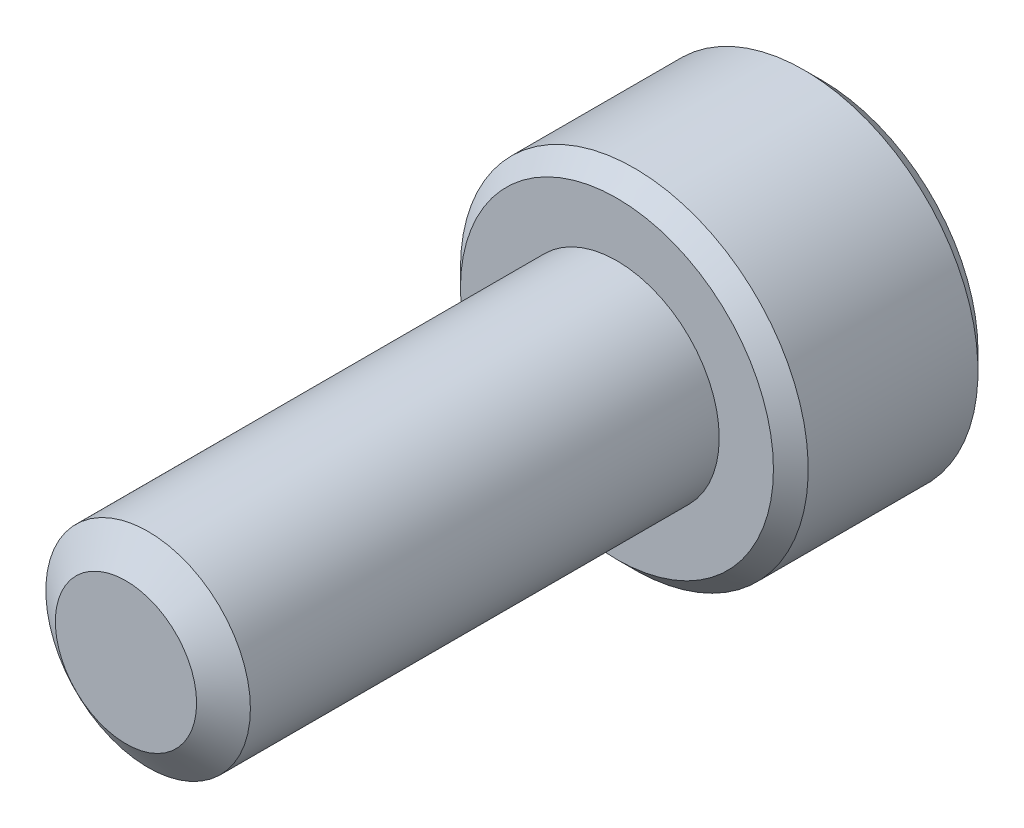
from build123d import *

# Parameters (mm, degrees)
SKETCH1_R          = 2.5
EXTRUDE1_DEPTH     = 12
SKETCH6_R          = 4.25
EXTRUDE2_DEPTH     = 5
CUT_EXTRUDE1_DEPTH = 3
CHAMFER1_SIZE      = 0.425


with BuildPart() as part:
    # Sketch1 → Extrude1 (new body)
    with BuildSketch(Plane.XY):
        Circle(SKETCH1_R)
    extrude(amount=-EXTRUDE1_DEPTH)

    # Sketch4 → Cut-Revolve1 (revolve, cut)
    with BuildSketch(Plane(origin=(0, 0, 0), x_dir=(0, 0, -1), z_dir=(1, 0, 0))):
        Polygon((0.541691224, 2.5), (0, 1.726384758), (0, 2.5), align=None)
    revolve(axis=Axis((0, 0, 0), (0, 0, -1)), mode=Mode.SUBTRACT)

    # Sketch6 → Extrude2 (add)
    with BuildSketch(Plane(origin=(0, 0, -12), x_dir=(-1, 0, 0), z_dir=(0, 0, -1))):
        Circle(SKETCH6_R)
    extrude(amount=EXTRUDE2_DEPTH)

    # Sketch7 → Cut-Extrude1 (cut)
    with BuildSketch(Plane(origin=(0, 0, -17), x_dir=(-1, 0, 0), z_dir=(0, 0, -1))):
        Polygon((0, 2.309401077), (-2, 1.154700538), (-2, -1.154700538), (0, -2.309401077), (2, -1.154700538), (2, 1.154700538), align=None)
    extrude(amount=-CUT_EXTRUDE1_DEPTH, mode=Mode.SUBTRACT)

    # Cut-Extrude2 cone 1 section (through the dimple's axis) → Cut-Extrude2 (revolve, cut)
    with BuildSketch(Plane(origin=(0, 0, -17), x_dir=(0, 1, 0), z_dir=(1, 0, 0))):
        Polygon((0, 0), (2.309401077, 0), (0, 2.309401077), align=None)
    revolve(axis=Axis((0, 0, -17), (0, 0, 1)), mode=Mode.SUBTRACT)

    # Chamfer1
    chamfer1_edges = [part.edges().sort_by_distance(p)[0] for p in [
        (4.25, 0, -17),
        (4.25, 0, -12),
    ]]
    chamfer(chamfer1_edges, length=CHAMFER1_SIZE)


solid = part.part
